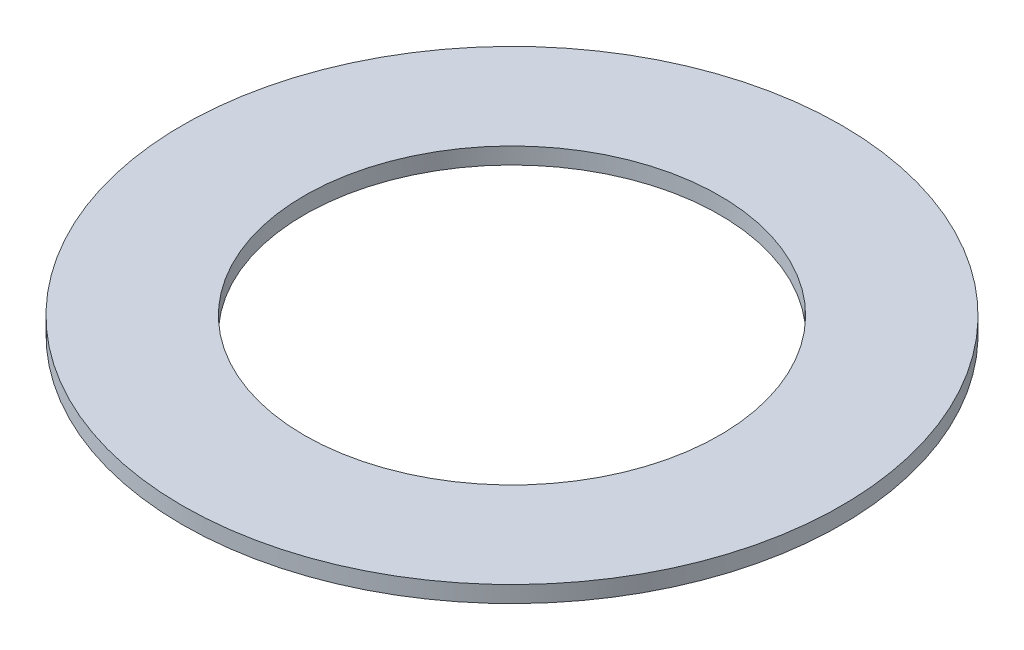
from build123d import *

# Parameters (mm, degrees)
SKETCH1_R           = 63.5
BOSS_EXTRUDE1_DEPTH = 3.18
SKETCH2_R           = 40.005
CUT_EXTRUDE1_DEPTH  = 3.18


with BuildPart() as part:
    # Sketch1 → Boss-Extrude1 (new body)
    with BuildSketch(Plane(origin=(0, 0, 0), x_dir=(1, 0, 0), z_dir=(0, 1, 0))):
        Circle(SKETCH1_R)
    extrude(amount=BOSS_EXTRUDE1_DEPTH)

    # Sketch2 → Cut-Extrude1 (cut)
    with BuildSketch(Plane(origin=(0, 3.18, 0), x_dir=(1, 0, 0), z_dir=(0, 1, 0))):
        Circle(SKETCH2_R)
    extrude(amount=-CUT_EXTRUDE1_DEPTH, mode=Mode.SUBTRACT)


solid = part.part
